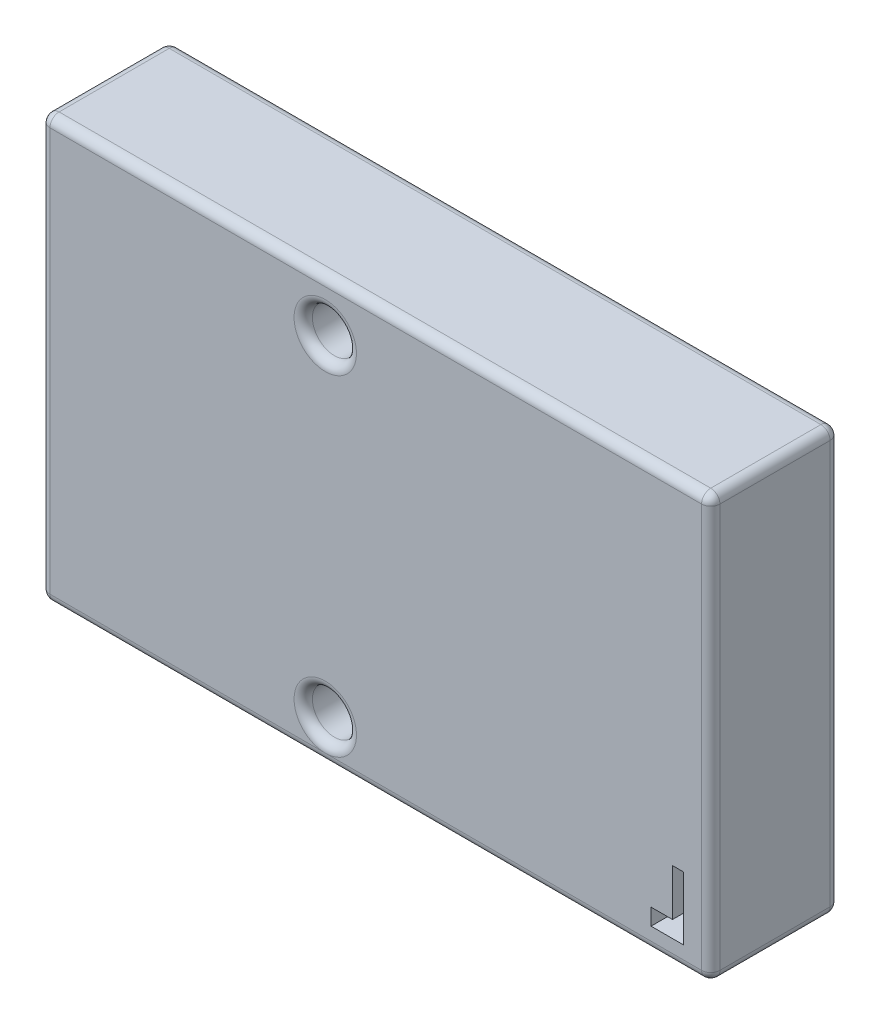
from build123d import *

# Parameters (mm, degrees)
SKETCH1_W           = 36.5
SKETCH1_H           = 7
BOSS_EXTRUDE1_DEPTH = 23
SKETCH2_R           = 1.375
CUT_EXTRUDE1_DEPTH  = 8.5
SKETCH4_R           = 1.2
CUT_EXTRUDE2_DEPTH  = 7
FILLET1_R           = 0.5
CUT_EXTRUDE3_DEPTH  = 44.706406853


with BuildPart() as part:
    # Sketch1 → Boss-Extrude1 (new body)
    with BuildSketch(Plane(origin=(0, 0, 0), x_dir=(1, 0, 0), z_dir=(0, 1, 0))):
        with Locations((18.25, -3.5)):
            Rectangle(SKETCH1_W, SKETCH1_H)
    extrude(amount=BOSS_EXTRUDE1_DEPTH)

    # Sketch2 → Cut-Extrude1 (cut)
    with BuildSketch(Plane.XZ):
        with Locations(Location((8, 3, 0), (0, 0, 270))):
            Circle(SKETCH2_R)
        with Locations(Location((28.5, 3, 0), (0, 0, 270))):
            Circle(SKETCH2_R)
    extrude(amount=-CUT_EXTRUDE1_DEPTH, mode=Mode.SUBTRACT)

    # Sketch4 → Cut-Extrude2 (cut)
    with BuildSketch(Plane(origin=(0, 0, 0), x_dir=(-1, 0, 0), z_dir=(0, 0, -1))):
        with Locations((-15.5, 2.2)):
            Circle(SKETCH4_R)
        with Locations((-15.5, 20.2)):
            Circle(SKETCH4_R)
    extrude(amount=-CUT_EXTRUDE2_DEPTH, mode=Mode.SUBTRACT)

    # Fillet1
    fillet1_edges = [part.edges().sort_by_distance(p)[0] for p in [
        (36.5, 23, 3.5),
        (8, 0, 4.375),
        (18.25, 23, 0),
        (28.5, 0, 4.375),
        (16.7, 2.2, 7),
        (16.7, 2.2, 0),
        (16.7, 20.2, 7),
        (16.7, 20.2, 0),
        (0, 23, 3.5),
        (18.25, 0, 0),
        (36.5, 0, 3.5),
        (18.25, 0, 7),
        (0, 0, 3.5),
        (0, 11.5, 0),
        (36.5, 11.5, 0),
        (36.5, 11.5, 7),
        (0, 11.5, 7),
        (18.25, 23, 7),
    ]]
    fillet(fillet1_edges, radius=FILLET1_R - 0.0001)  # a hair under: the kernel refuses the full size

    # Sketch5 → Cut-Extrude3 (cut, through all)
    with BuildSketch(Plane(origin=(0, 0, 0), x_dir=(-1, 0, 0), z_dir=(0, 0, -1))):
        Polygon((-35.01478763, 4.65210946), (-35.01478763, 1.209340572), (-33.248497505, 1.209340572), (-33.248497505, 2.107454195), (-34.416045215, 2.107454195), (-34.416045215, 4.65210946), align=None)
    extrude(amount=-CUT_EXTRUDE3_DEPTH, mode=Mode.SUBTRACT)


solid = part.part
